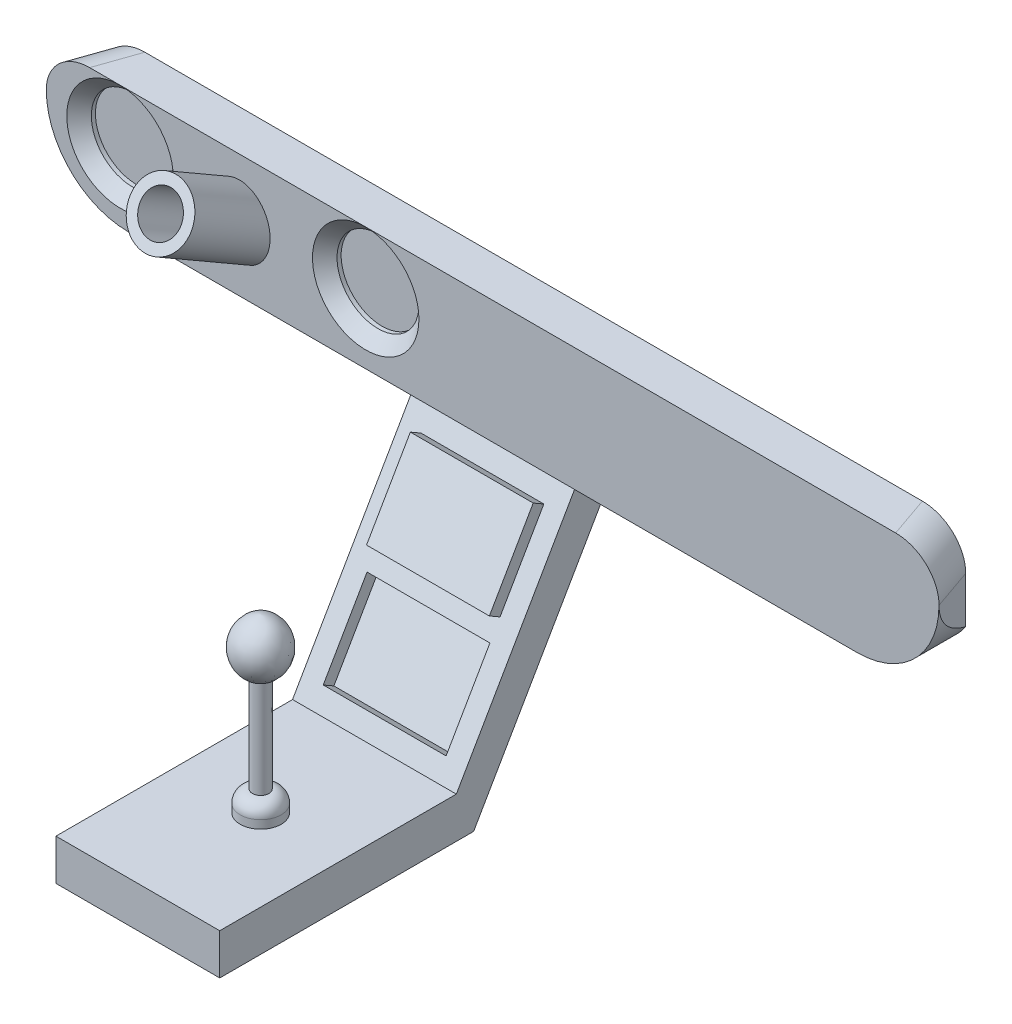
from build123d import *

# Parameters (mm, degrees)
IZIM1_W                     = 218
IZIM1_H                     = 30
Y_KSEKLIK_EKSTR_ZYON1_DEPTH = 5
RADYUS1_R                   = 20
IZIM3_R                     = 10
KES_EKSTR_ZYON1_DEPTH       = 4
PAH1_SIZE                   = 3
IZIM5_R                     = 5
KES_EKSTR_ZYON3_DEPTH       = 119.749210232
Y_KSEKLIK_EKSTR_ZYON2_DEPTH = 20
IZIM9_W                     = 30
IZIM9_H                     = 21.4
Y_KSEKLIK_EKSTR_ZYON3_DEPTH = 3
IZIM9_3_W                   = 30
IZIM9_3_H                   = 21.4
KES_EKSTR_ZYON4_DEPTH       = 3
KES_EKSTR_ZYON5_DEPTH       = 40
RADYUS2_R                   = 10
RADYUS2_OF_AYNALAMA1_R      = 10


with BuildPart() as part:
    # Çizim1 → Yükseklik-Ekstrüzyon1 (new, symmetric)
    with BuildSketch(Plane.XY):
        Rectangle(IZIM1_W, IZIM1_H)
    extrude(amount=Y_KSEKLIK_EKSTR_ZYON1_DEPTH, both=True)

    # Radyus1
    radyus1_edges = [part.edges().sort_by_distance(p)[0] for p in [
        (109, -15, 0),
        (-109, -15, 0),
    ]]
    fillet(radyus1_edges, radius=RADYUS1_R)

    # Çizim3 → Kes-Ekstrüzyon1 (cut)
    with BuildSketch(Plane.XY.offset(5)):
        with Locations((-91, 2)):
            Circle(IZIM3_R)
        with Locations((-31, 2)):
            Circle(IZIM3_R)
    extrude(amount=-KES_EKSTR_ZYON1_DEPTH, mode=Mode.SUBTRACT)

    # Pah1
    pah1_edges = [part.edges().sort_by_distance(p)[0] for p in [
        (-101, 2, 5),
        (-41, 2, 5),
    ]]
    chamfer(pah1_edges, length=PAH1_SIZE - 0.0001)  # a hair under: the kernel refuses the full size

    # Çizim4 → Döndür1 (revolve)
    with BuildSketch(Plane(origin=(-61.85, 0, 0), x_dir=(0, 0, -1), z_dir=(1, 0, 0)), mode=Mode.PRIVATE) as d_nd_r1_sk:
        Polygon((-20.498711306, 18.495190528), (-24.248711306, 12), (10.392304845, -8), (14.142304845, -1.504809472), align=None)
    revolve(d_nd_r1_sk.sketch.rotate(Axis((-61.85, 12, 24.248711306), (0, -0.49999999999999767, -0.86602540378444)), 180), axis=Axis((-61.85, 12, 24.248711306), (0, -0.49999999999999767, -0.86602540378444)))

    # Çizim5 → Kes-Ekstrüzyon3 (cut, through all)
    with BuildSketch(Plane(origin=(0, 13.5, 23.382685902), x_dir=(1, 0, 0), z_dir=(0, 0.4999999999999978, 0.86602540378444))):
        with Locations(Location((-61.85, -1.732050808, 0), (0, 0, 270))):
            Circle(IZIM5_R)
    extrude(amount=-KES_EKSTR_ZYON3_DEPTH, mode=Mode.SUBTRACT)

    # Çizim7 → Yükseklik-Ekstrüzyon2 (add, symmetric)
    with BuildSketch(Plane(origin=(0, 0, 0), x_dir=(0, 0, -1), z_dir=(1, 0, 0))):
        Polygon((5, -15), (-5, -15), (-33.867513459, -65), (-91.641016151, -65), (-91.641016151, -75), (-29.641016151, -75), align=None)
    extrude(amount=Y_KSEKLIK_EKSTR_ZYON2_DEPTH, both=True)

    # Çizim9 → Yükseklik-Ekstrüzyon3 (add)
    with BuildSketch(Plane(origin=(0, -1.584936491, -2.745190528), x_dir=(1, 0, 0), z_dir=(0, 0.4999999999999977, 0.86602540378444))):
        with Locations((0, -31.190381057)):
            Rectangle(IZIM9_W, IZIM9_H)
    extrude(amount=Y_KSEKLIK_EKSTR_ZYON3_DEPTH)

    # Çizim9<3> → Kes-Ekstrüzyon4 (cut)
    with BuildSketch(Plane(origin=(0, -1.584936491, -2.745190528), x_dir=(1, 0, 0), z_dir=(0, 0.4999999999999977, 0.86602540378444))):
        with Locations((0, -57.525407976)):
            Rectangle(IZIM9_3_W, IZIM9_3_H)
    extrude(amount=-KES_EKSTR_ZYON4_DEPTH, mode=Mode.SUBTRACT)

    # Çizim11 → Döndür2 (revolve)
    with BuildSketch(Plane(origin=(0, 0, 0), x_dir=(0, 0, -1), z_dir=(1, 0, 0)), mode=Mode.PRIVATE) as d_nd_r2_sk:
        with BuildLine():
            Line((-61.641016151, -23.147719704), (-61.641016151, -85))
            Line((-61.641016151, -85), (-54.141016151, -85))
            Line((-54.141016151, -85), (-54.141016151, -75))
            Line((-54.141016151, -75), (-56.641016151, -75))
            Line((-56.641016151, -75), (-56.641016151, -63))
            ThreePointArc((-56.641016151, -63), (-57.519695808, -60.878679656), (-59.641016151, -60))
            Line((-59.641016151, -60), (-59.641016151, -36.252262247))
            ThreePointArc((-59.641016151, -36.252262247), (-55.765967633, -28.955966756), (-61.641016151, -23.147719704))
        make_face()
    revolve(d_nd_r2_sk.sketch.rotate(Axis((0, -23.147719704, 61.641016151), (0, -1, 0)), 180), axis=Axis((0, -23.147719704, 61.641016151), (0, -1, 0)))

    # Çizim12 → Kes-Ekstrüzyon5 (cut)
    with BuildSketch(Plane(origin=(0, 15, 0), x_dir=(1, 0, 0), z_dir=(0, 1, 0))):
        Polygon((-109, 5), (-109, -5), (-105.52, 5), align=None)
    kes_ekstr_zyon5 = extrude(amount=-KES_EKSTR_ZYON5_DEPTH, mode=Mode.SUBTRACT)

    # Radyus2
    radyus2_edges = [part.edges().sort_by_distance(p)[0] for p in [
        (-107.26, 15, 0),
    ]]
    fillet(radyus2_edges, radius=RADYUS2_R)

    # Aynalama1: Kes-Ekstrüzyon5 across plane
    add(kes_ekstr_zyon5.mirror(Plane(origin=(0, 0, 0), x_dir=(0, 0, 1), z_dir=(1, 0, 0))), mode=Mode.SUBTRACT)

    # Radyus2 of Aynalama1
    radyus2_of_aynalama1_edges = [part.edges().sort_by_distance(p)[0] for p in [
        (107.26, 15, 0),
    ]]
    fillet(radyus2_of_aynalama1_edges, radius=RADYUS2_OF_AYNALAMA1_R)


solid = part.part
